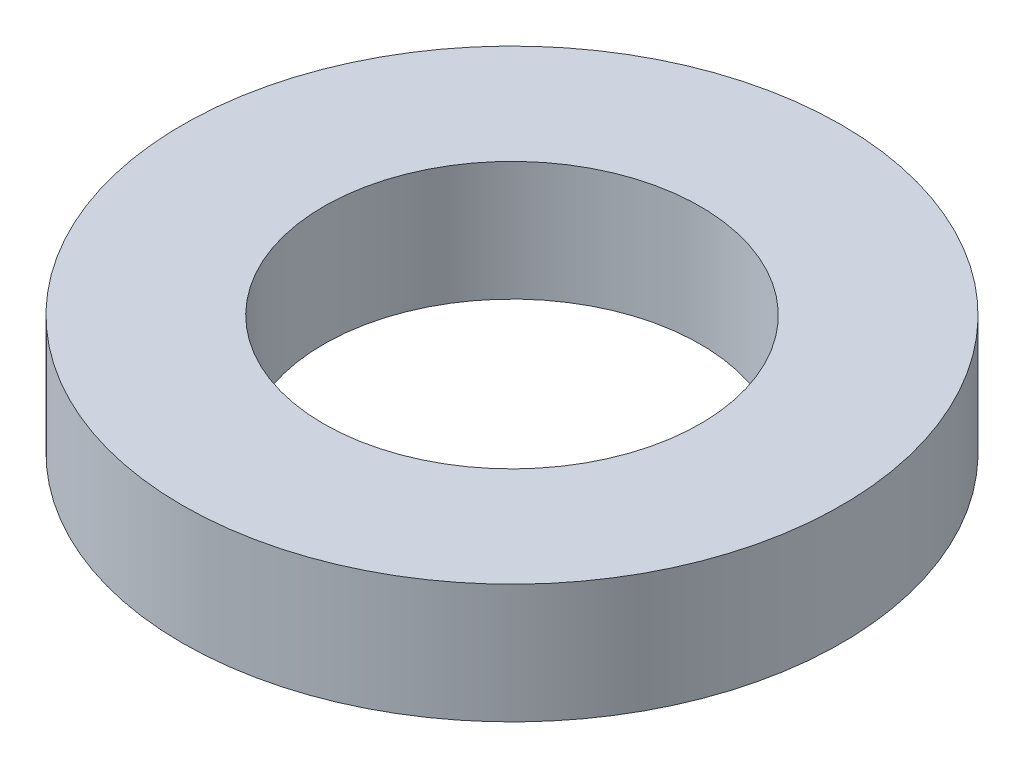
from build123d import *

# Parameters (mm, degrees)
SKETCH1_R           = 52.5
BOSS_EXTRUDE1_DEPTH = 19
SKETCH2_R           = 30
CUT_EXTRUDE1_DEPTH  = 77.638763038


with BuildPart() as part:
    # Sketch1 → Boss-Extrude1 (new body)
    with BuildSketch(Plane(origin=(0, 0, 0), x_dir=(1, 0, 0), z_dir=(0, 1, 0))):
        Circle(SKETCH1_R)
    extrude(amount=BOSS_EXTRUDE1_DEPTH)

    # Sketch2 → Cut-Extrude1 (cut, through all)
    with BuildSketch(Plane(origin=(0, 0, 0), x_dir=(1, 0, 0), z_dir=(0, 1, 0))):
        Circle(SKETCH2_R)
    extrude(amount=CUT_EXTRUDE1_DEPTH, mode=Mode.SUBTRACT)


solid = part.part
